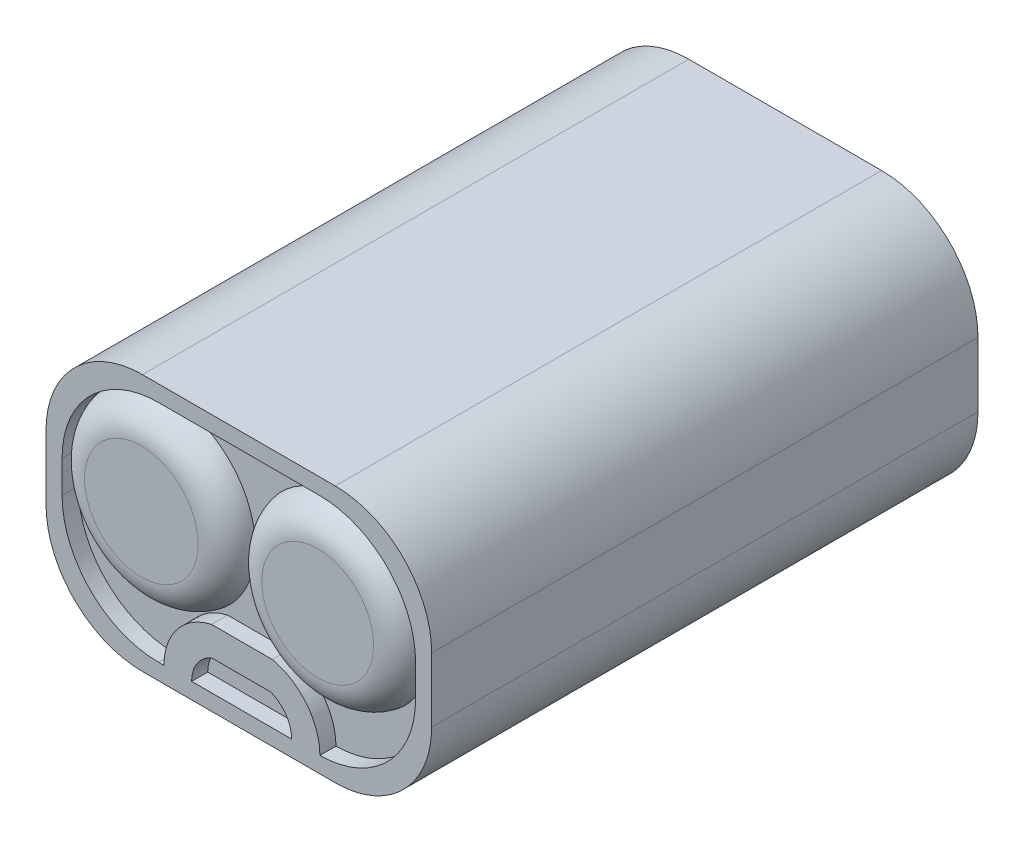
from build123d import *

# Parameters (mm, degrees)
SKETCH1_W           = 30.48
SKETCH1_H           = 43.18
BOSS_EXTRUDE1_DEPTH = 20.32
FILLET1_R           = 7.62
CUT_EXTRUDE2_DEPTH  = 1.27
SKETCH3_R           = 6.979927777
SKETCH3_R_2         = 6.904229814
BOSS_EXTRUDE2_DEPTH = 2.032
FILLET2_R           = 2.54


with BuildPart() as part:
    # Sketch1 → Boss-Extrude1 (new body)
    with BuildSketch(Plane(origin=(0, 0, 0), x_dir=(1, 0, 0), z_dir=(0, 1, 0))):
        Rectangle(SKETCH1_W, SKETCH1_H)
    extrude(amount=BOSS_EXTRUDE1_DEPTH)

    # Fillet1
    fillet1_edges = [part.edges().sort_by_distance(p)[0] for p in [
        (15.24, 20.32, 0),
        (-15.24, 20.32, 0),
        (15.24, 0, 0),
        (-15.24, 0, 0),
    ]]
    fillet(fillet1_edges, radius=FILLET1_R)

    # Sketch2 → Cut-Extrude2 (cut)
    with BuildSketch(Plane.XY.offset(21.59)):
        with BuildLine():
            Line((-3.729733948, 1.27), (4.173096077, 1.27))
            ThreePointArc((4.173096077, 1.27), (3.721271351, 2.723698057), (2.525007795, 3.66515285))
            Line((2.525007795, 3.66515285), (-2.15658026, 3.66515285))
            ThreePointArc((-2.15658026, 3.66515285), (-3.301276498, 2.702791829), (-3.729733948, 1.27))
        make_face()
        with BuildLine():
            ThreePointArc((2.645377511, 5.955761741), (5.350660012, 4.274727675), (6.407709564, 1.270218533))
            ThreePointArc((6.407709564, 1.270218533), (11.758518599, 3.522288517), (13.97, 8.89))
            Line((13.97, 8.89), (13.97, 11.43))
            ThreePointArc((13.97, 11.43), (11.738153673, 16.818153673), (6.35, 19.05))
            Line((6.35, 19.05), (-6.35, 19.05))
            ThreePointArc((-6.35, 19.05), (-11.738153673, 16.818153673), (-13.97, 11.43))
            Line((-13.97, 11.43), (-13.97, 8.89))
            ThreePointArc((-13.97, 8.89), (-11.738153673, 3.501846327), (-6.35, 1.27))
            Line((-6.35, 1.27), (-5.918912318, 1.27))
            ThreePointArc((-5.918912318, 1.27), (-4.861931172, 4.274642475), (-2.15658026, 5.955761741))
            Line((-2.15658026, 5.955761741), (2.645377511, 5.955761741))
        make_face()
    extrude(amount=-CUT_EXTRUDE2_DEPTH, mode=Mode.SUBTRACT)

    # Sketch3 → Boss-Extrude2 (add)
    with BuildSketch(Plane.XY.offset(20.32)):
        with Locations((-6.939175258, 11.673649258)):
            Circle(SKETCH3_R)
        with Locations((6.997365407, 11.673649258)):
            Circle(SKETCH3_R_2)
    extrude(amount=BOSS_EXTRUDE2_DEPTH)

    # Fillet2
    # the kernel refuses this fillet: 2.54 mm, written as the material it takes off along each edge
    with BuildSketch(Plane(origin=(-6.939175258, 11.673649258, 22.352), x_dir=(1, 0, 0), z_dir=(0, -1, 0))) as fillet2_piece_1:
        with BuildLine():
            CenterArc((4.491246199, -2.54), FILLET2_R, 11.536959033, 78.463040967)
            Line((4.491246199, 0), (6.979927777, 0))
            Line((6.979927777, 0), (6.979927777, -2.032))
        make_face()
    revolve(axis=Axis((-6.939175258, 11.673649258, 22.352), (0, 0, 1)), mode=Mode.SUBTRACT)
    with BuildSketch(Plane(origin=(6.997365407, 11.673649258, 22.352), x_dir=(1, 0, 0), z_dir=(0, -1, 0))) as fillet2_piece_2:
        with BuildLine():
            CenterArc((4.415548235, -2.54), FILLET2_R, 11.536959033, 78.463040967)
            Line((4.415548235, 0), (6.904229814, 0))
            Line((6.904229814, 0), (6.904229814, -2.032))
        make_face()
    revolve(axis=Axis((6.997365407, 11.673649258, 22.352), (0, 0, 1)), mode=Mode.SUBTRACT)


solid = part.part
